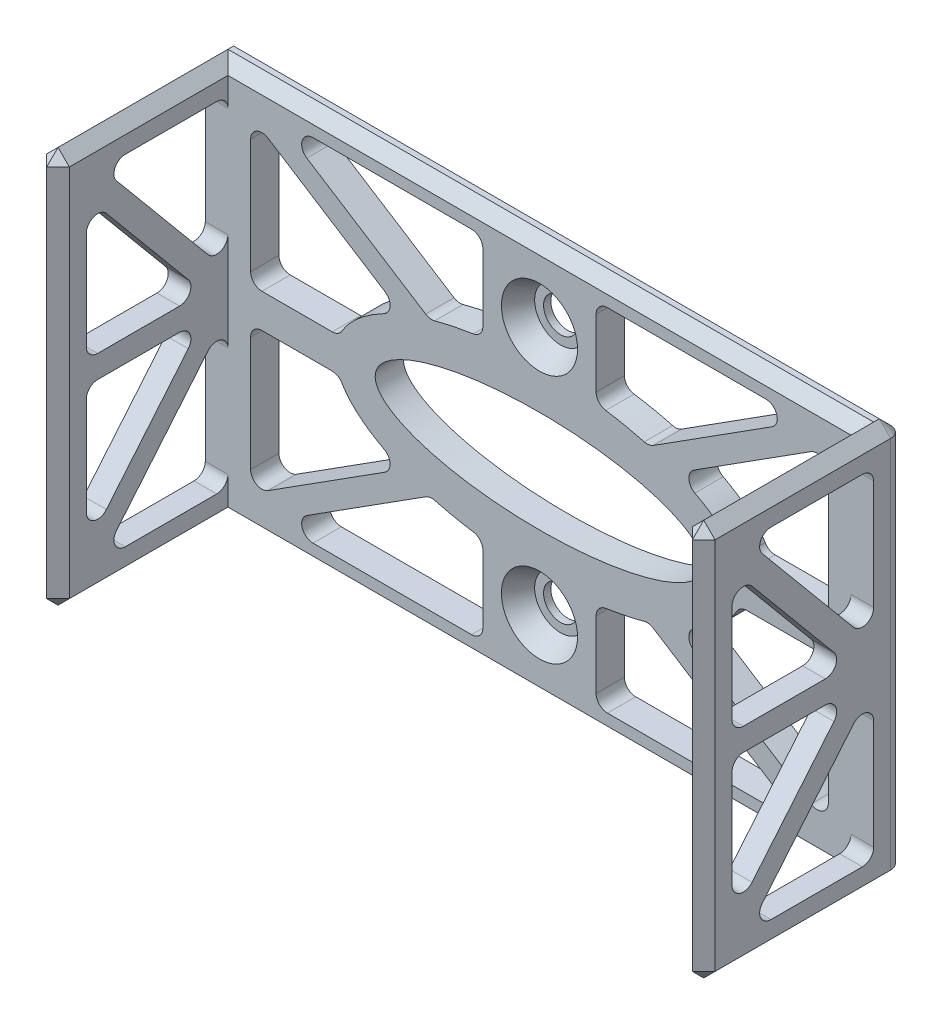
from build123d import *

# Parameters (mm, degrees)
SKETCH1_W                    = 110
SKETCH1_H                    = 70
SKETCH1_R                    = 3
BOSS_EXTRUDE1_DEPTH          = 5
SKETCH2_R                    = 6.72
CUT_EXTRUDE1_DEPTH           = 3.72
CUT_EXTRUDE1_DRAFT           = -30
CUT_EXTRUDE1_PROFILE_2_DEPTH = 3.72
CUT_EXTRUDE1_PROFILE_2_DRAFT = -30
CUT_EXTRUDE2_DEPTH           = 66.383484153
SKETCH5_RX                   = 29
SKETCH5_RY                   = 9
CUT_EXTRUDE3_DEPTH           = 66.383484298
SKETCH6_W                    = 35
SKETCH6_H                    = 70
BOSS_EXTRUDE2_DEPTH          = 4
CUT_EXTRUDE4_DEPTH           = 128.960931657
CUT_EXTRUDE4_DEPTH_BACK      = 128.960931657
FILLET2_R                    = 2
CHAMFER2_SIZE                = 2


with BuildPart() as part:
    # Sketch1 → Boss-Extrude1 (new body)
    with BuildSketch(Plane.XY):
        Rectangle(SKETCH1_W, SKETCH1_H)
        with Locations((0, 22)):
            Circle(SKETCH1_R, mode=Mode.SUBTRACT)
        with Locations((0, -22)):
            Circle(SKETCH1_R, mode=Mode.SUBTRACT)
    extrude(amount=BOSS_EXTRUDE1_DEPTH)


with BuildPart() as cut_extrude1_tool:
    # Sketch2 → Cut-Extrude1 (with draft: the straight prism first)
    with BuildSketch(Plane.XY.offset(5)):
        with Locations((0, 22)):
            Circle(SKETCH2_R)
    extrude(amount=-CUT_EXTRUDE1_DEPTH)
    # Cut-Extrude1: the draft: its side faces are tilted about the plane it starts from
    cut_extrude1_sides = [cut_extrude1_tool.faces().sort_by_distance(p)[0] for p in [
        (-6.72, 22, 3.14),
    ]]
    draft(cut_extrude1_sides, Plane.XY.offset(5), CUT_EXTRUDE1_DRAFT)


with BuildPart() as part_1:
    add(part.part)

    # Cut-Extrude1: cut by cut_extrude1_tool
    add(cut_extrude1_tool.part, mode=Mode.SUBTRACT)


with BuildPart() as cut_extrude1_profile_2_tool:
    # Sketch2 → Cut-Extrude1 profile 2 (with draft: the straight prism first)
    with BuildSketch(Plane.XY.offset(5)):
        with Locations((0, -22)):
            Circle(SKETCH2_R)
    extrude(amount=-CUT_EXTRUDE1_PROFILE_2_DEPTH)
    # Cut-Extrude1 profile 2: the draft: its side faces are tilted about the plane it starts from
    cut_extrude1_profile_2_sides = [cut_extrude1_profile_2_tool.faces().sort_by_distance(p)[0] for p in [
        (-6.72, -22, 3.14),
    ]]
    draft(cut_extrude1_profile_2_sides, Plane.XY.offset(5), CUT_EXTRUDE1_PROFILE_2_DRAFT)


with BuildPart() as part_2:
    add(part_1.part)

    # Cut-Extrude1 profile 2: cut by cut_extrude1_profile_2_tool
    add(cut_extrude1_profile_2_tool.part, mode=Mode.SUBTRACT)

    # Sketch3 → Cut-Extrude2 (cut, through all)
    with BuildSketch(Plane.XY.offset(5)):
        with BuildLine():
            Line((-24.201461175, 11.845001254), (-51, 28.89861687))
            Line((-51, 28.89861687), (-51, 3))
            Line((-51, 3), (-35.361525702, 3))
            add(Edge.make_bspline(
                [(-24.201461175, 11.845001254), (-33.106208036, 8.251125835), (-35.361525702, 3)],
                knots=[2.30805745, 2.30805745, 2.30805745, 2.952976267, 2.952976267, 2.952976267], degree=2, weights=[1, 0.9484589, 1]))
        make_face()
        with BuildLine():
            Line((-46.851656456, 31), (-19.342685881, 13.494291453))
            add(Edge.make_bspline(
                [(-10, 15.370325747), (-14.974953396, 14.730972451), (-19.342685881, 13.494291453)],
                knots=[1.8522764, 1.8522764, 1.8522764, 2.138025039, 2.138025039, 2.138025039], degree=2, weights=[1, 0.989810815, 1]))
            Line((-10, 15.370325747), (-10, 31))
            Line((-10, 31), (-46.851656456, 31))
        make_face()
        with BuildLine():
            add(Edge.make_bspline(
                [(-35.361525702, -3), (-33.106208036, -8.251125835), (-24.201461175, -11.845001254)],
                knots=[3.33020904, 3.33020904, 3.33020904, 3.975127858, 3.975127858, 3.975127858], degree=2, weights=[1, 0.9484589, 1]))
            Line((-35.361525702, -3), (-51, -3))
            Line((-51, -3), (-51, -28.89861687))
            Line((-51, -28.89861687), (-24.201461175, -11.845001254))
        make_face()
        with BuildLine():
            Line((10, 31), (10, 15.370325747))
            add(Edge.make_bspline(
                [(19.342685881, 13.494291453), (14.974953396, 14.730972451), (10, 15.370325747)],
                knots=[1.003567614, 1.003567614, 1.003567614, 1.289316254, 1.289316254, 1.289316254], degree=2, weights=[1, 0.989810815, 1]))
            Line((19.342685881, 13.494291453), (46.851656456, 31))
            Line((46.851656456, 31), (10, 31))
        make_face()
        with BuildLine():
            add(Edge.make_bspline(
                [(-19.342685881, -13.494291453), (-14.974953396, -14.730972451), (-10, -15.370325747)],
                knots=[4.145160268, 4.145160268, 4.145160268, 4.430908907, 4.430908907, 4.430908907], degree=2, weights=[1, 0.989810815, 1]))
            Line((-19.342685881, -13.494291453), (-46.851656456, -31))
            Line((-46.851656456, -31), (-10, -31))
            Line((-10, -31), (-10, -15.370325747))
        make_face()
        with BuildLine():
            Line((51, 28.89861687), (24.201461175, 11.845001254))
            add(Edge.make_bspline(
                [(35.361525702, 3), (33.106208036, 8.251125835), (24.201461175, 11.845001254)],
                knots=[0.188616386, 0.188616386, 0.188616386, 0.833535204, 0.833535204, 0.833535204], degree=2, weights=[1, 0.9484589, 1]))
            Line((35.361525702, 3), (51, 3))
            Line((51, 3), (51, 28.89861687))
        make_face()
        with BuildLine():
            add(Edge.make_bspline(
                [(10, -15.370325747), (14.974953396, -14.730972451), (19.342685881, -13.494291453)],
                knots=[4.993869054, 4.993869054, 4.993869054, 5.279617693, 5.279617693, 5.279617693], degree=2, weights=[1, 0.989810815, 1]))
            Line((10, -15.370325747), (10, -31))
            Line((10, -31), (46.851656456, -31))
            Line((46.851656456, -31), (19.342685881, -13.494291453))
        make_face()
        with BuildLine():
            add(Edge.make_bspline(
                [(24.201461175, -11.845001254), (33.106208036, -8.251125835), (35.361525702, -3)],
                knots=[5.449650103, 5.449650103, 5.449650103, 6.094568921, 6.094568921, 6.094568921], degree=2, weights=[1, 0.9484589, 1]))
            Line((24.201461175, -11.845001254), (51, -28.89861687))
            Line((51, -28.89861687), (51, -3))
            Line((51, -3), (35.361525702, -3))
        make_face()
    extrude(amount=-CUT_EXTRUDE2_DEPTH, mode=Mode.SUBTRACT)

    # Sketch5 → Cut-Extrude3 (cut, through all)
    with BuildSketch(Plane.XY.offset(5)):
        with Locations(Location((0, 0), (0, 0, 0))):
            Ellipse(SKETCH5_RX, SKETCH5_RY)
    extrude(amount=-CUT_EXTRUDE3_DEPTH, mode=Mode.SUBTRACT)

    # Sketch6 → Boss-Extrude2 (add)
    with BuildSketch(Plane.ZY.offset(55)):
        with Locations((17.5, 0)):
            Rectangle(SKETCH6_W, SKETCH6_H)
    boss_extrude2 = extrude(amount=BOSS_EXTRUDE2_DEPTH)

    # Mirror1: Boss-Extrude2 across plane
    add(boss_extrude2.mirror(Plane(origin=(0, 0, 0), x_dir=(0, 0, 1), z_dir=(1, 0, 0))))

    # Sketch7 → Cut-Extrude4 (cut, two sides: drawn at the far end of the back side and taken through both)
    with BuildSketch(Plane(origin=(59, 0, 0), x_dir=(0, 0, -1), z_dir=(1, 0, 0)).offset(-CUT_EXTRUDE4_DEPTH_BACK)):
        Polygon((-27.396583441, 30), (-5, 30), (-5, 3.12409987), align=None)
        Polygon((-30, 26.87590013), (-30, 2), (-9.270083225, 2), align=None)
        Polygon((-27.396583441, -30), (-5, -30), (-5, -3.12409987), align=None)
        Polygon((-9.270083225, -2), (-30, -26.87590013), (-30, -2), align=None)
    extrude(amount=CUT_EXTRUDE4_DEPTH + CUT_EXTRUDE4_DEPTH_BACK, mode=Mode.SUBTRACT)

    # Fillet2
    fillet2_edges = [part_2.edges().sort_by_distance(p)[0] for p in [
        (10, -15.370325747, 2.5),
        (10, -31, 2.5),
        (19.342685881, -13.494291453, 2.5),
        (46.851656456, -31, 2.5),
        (51, -28.89861687, 2.5),
        (24.201461175, -11.845001254, 2.5),
        (35.361525702, -3, 2.5),
        (51, -3, 2.5),
        (35.361525702, 3, 2.5),
        (24.201461175, 11.845001254, 2.5),
        (51, 3, 2.5),
        (51, 28.89861687, 2.5),
        (10, 31, 2.5),
        (46.851656456, 31, 2.5),
        (19.342685881, 13.494291453, 2.5),
        (10, 15.370325747, 2.5),
        (-10, -31, 2.5),
        (-10, -15.370325747, 2.5),
        (-19.342685881, -13.494291453, 2.5),
        (-46.851656456, -31, 2.5),
        (-51, -28.89861687, 2.5),
        (-24.201461175, -11.845001254, 2.5),
        (-35.361525702, -3, 2.5),
        (-51, -3, 2.5),
        (-51, 3, 2.5),
        (-35.361525702, 3, 2.5),
        (-24.201461175, 11.845001254, 2.5),
        (-51, 28.89861687, 2.5),
        (-19.342685881, 13.494291453, 2.5),
        (-10, 15.370325747, 2.5),
        (-10, 31, 2.5),
        (-46.851656456, 31, 2.5),
        (57, -30, 5),
        (57, 26.87590013, 30),
        (57, 30, 27.396583441),
        (57, 2, 30),
        (57, -2, 30),
        (57, -26.87590013, 30),
        (57, -30, 27.396583441),
        (57, 3.12409987, 5),
        (57, 2, 9.270083225),
        (57, -3.12409987, 5),
        (57, -2, 9.270083225),
        (57, 30, 5),
        (-57, -2, 30),
        (-57, 30, 27.396583441),
        (-57, 26.87590013, 30),
        (-57, 2, 9.270083225),
        (-57, -2, 9.270083225),
        (-57, -3.12409987, 5),
        (-57, 2, 30),
        (-57, -30, 27.396583441),
        (-57, -26.87590013, 30),
        (-57, -30, 5),
        (-57, 3.12409987, 5),
        (-57, 30, 5),
        (-59, 0, 0),
        (59, 0, 0),
    ]]
    fillet(fillet2_edges, radius=FILLET2_R)

    # Chamfer2
    chamfer2_edges = [part_2.edges().sort_by_distance(p)[0] for p in [
        (-55, -35, 20),
        (-55, 0, 35),
        (-57, -35, 35),
        (-55, 35, 20),
        (-57, 35, 35),
        (-59, 0, 35),
        (-59, 35, 18.5),
        (0, -35, 5),
        (59, 35, 18.5),
        (59, 0, 35),
        (57, 35, 35),
        (57, -35, 35),
        (55, -35, 20),
        (55, 0, 35),
        (55, 35, 20),
        (-59, -35, 18.5),
        (0, -35, 0),
        (59, -35, 18.5),
        (58.414213562, -35, 0.585786438),
        (-58.414213562, -35, 0.585786438),
        (0, 35, 0),
        (58.414213562, 35, 0.585786438),
        (-58.414213562, 35, 0.585786438),
        (0, 35, 5),
    ]]
    chamfer(chamfer2_edges, length=CHAMFER2_SIZE - 0.0001)  # a hair under: the kernel refuses the full size


solid = part_2.part
